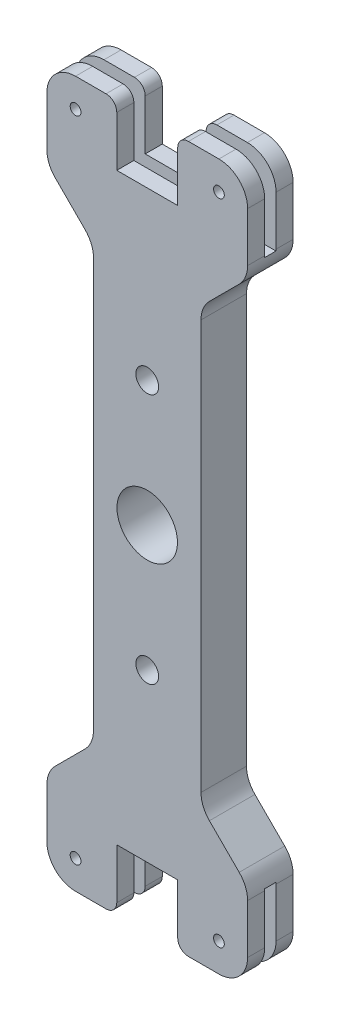
from build123d import *

# Parameters (mm, degrees)
SKETCH1_R           = 8.4375
SKETCH1_R_2         = 1.5
BOSS_EXTRUDE1_DEPTH = 6.35
FILLET1_R           = 8
SKETCH3_W           = 56
SKETCH3_H           = 3.175
CUT_EXTRUDE1_DEPTH  = 22.22
SKETCH4_R           = 3.175
CUT_EXTRUDE2_DEPTH  = 104.163053585


with BuildPart() as part:
    # Sketch1 → Boss-Extrude1 (new, symmetric)
    with BuildSketch(Plane.XY):
        with BuildLine():
            Line((-28, 73.397835534), (-28, 90.475))
            ThreePointArc((-28, 90.475), (-25.656854249, 96.131854249), (-20, 98.475))
            Line((-20, 98.475), (-11.5, 98.475))
            ThreePointArc((-11.5, 98.475), (-9.378679656, 97.596320344), (-8.5, 95.475))
            Line((-8.5, 95.475), (-8.5, 81.475))
            Line((-8.5, 81.475), (8.5, 81.475))
            Line((8.5, 81.475), (8.5, 95.475))
            ThreePointArc((8.5, 95.475), (9.378679656, 97.596320344), (11.5, 98.475))
            Line((11.5, 98.475), (20, 98.475))
            ThreePointArc((20, 98.475), (25.656854249, 96.131854249), (28, 90.475))
            Line((28, 90.475), (28, 73.397835534))
            Line((28, 73.397835534), (15, 60.397835534))
            Line((15, 60.397835534), (15, -60.397835534))
            Line((15, -60.397835534), (28, -73.397835534))
            Line((28, -73.397835534), (28, -90.475))
            ThreePointArc((28, -90.475), (25.656854249, -96.131854249), (20, -98.475))
            Line((20, -98.475), (11.5, -98.475))
            ThreePointArc((11.5, -98.475), (9.378679656, -97.596320344), (8.5, -95.475))
            Line((8.5, -95.475), (8.5, -81.475))
            Line((8.5, -81.475), (-8.5, -81.475))
            Line((-8.5, -81.475), (-8.5, -95.475))
            ThreePointArc((-8.5, -95.475), (-9.378679656, -97.596320344), (-11.5, -98.475))
            Line((-11.5, -98.475), (-20, -98.475))
            ThreePointArc((-20, -98.475), (-25.656854249, -96.131854249), (-28, -90.475))
            Line((-28, -90.475), (-28, -73.397835534))
            Line((-28, -73.397835534), (-15, -60.397835534))
            Line((-15, -60.397835534), (-15, 60.397835534))
            Line((-15, 60.397835534), (-28, 73.397835534))
        make_face()
        Circle(SKETCH1_R, mode=Mode.SUBTRACT)
        with Locations((-20, 90.475)):
            Circle(SKETCH1_R_2, mode=Mode.SUBTRACT)
        with Locations((20, 90.475)):
            Circle(SKETCH1_R_2, mode=Mode.SUBTRACT)
        with Locations((20, -90.475)):
            Circle(SKETCH1_R_2, mode=Mode.SUBTRACT)
        with Locations((-20, -90.475)):
            Circle(SKETCH1_R_2, mode=Mode.SUBTRACT)
    extrude(amount=BOSS_EXTRUDE1_DEPTH, both=True)

    # Fillet1
    fillet1_edges = [part.edges().sort_by_distance(p)[0] for p in [
        (-28, 73.397835534, 0),
        (-15, 60.397835534, 0),
        (-28, -73.397835534, 0),
        (-15, -60.397835534, 0),
        (15, -60.397835534, 0),
        (28, -73.397835534, 0),
        (28, 73.397835534, 0),
        (15, 60.397835534, 0),
    ]]
    fillet(fillet1_edges, radius=FILLET1_R)

    # Sketch3 → Cut-Extrude1 (cut)
    with BuildSketch(Plane(origin=(0, 98.475, 0), x_dir=(1, 0, 0), z_dir=(0, 1, 0))):
        Rectangle(SKETCH3_W, SKETCH3_H)
    cut_extrude1 = extrude(amount=-CUT_EXTRUDE1_DEPTH, mode=Mode.SUBTRACT)

    # Mirror1: Cut-Extrude1 across plane
    add(cut_extrude1.mirror(Plane.ZX), mode=Mode.SUBTRACT)

    # Sketch4 → Cut-Extrude2 (cut, through all)
    with BuildSketch(Plane.XY.offset(6.35)):
        with Locations((0, 35)):
            Circle(SKETCH4_R)
        with Locations((0, -35)):
            Circle(SKETCH4_R)
    extrude(amount=-CUT_EXTRUDE2_DEPTH, mode=Mode.SUBTRACT)


solid = part.part
